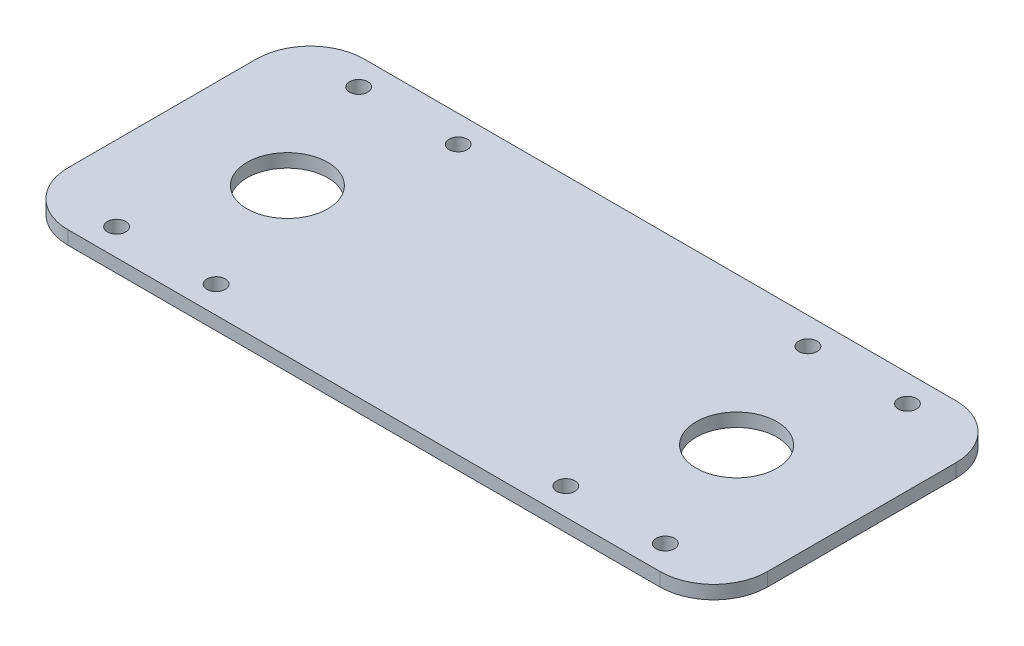
from build123d import *

# Parameters (mm, degrees)
BOSS_EXTRUDE1_DEPTH = 2.5
SKETCH2_R           = 1.7
CUT_EXTRUDE1_DEPTH  = 142.178079035
SKETCH3_R           = 1.7
CUT_EXTRUDE2_DEPTH  = 10
SKETCH4_R           = 7.5
CUT_EXTRUDE3_DEPTH  = 10


with BuildPart() as part:
    # Sketch1 → Boss-Extrude1 (new body)
    with BuildSketch(Plane(origin=(0, 0, 0), x_dir=(1, 0, 0), z_dir=(0, 1, 0))):
        with BuildLine():
            Line((10, 0), (120, 0))
            ThreePointArc((120, 0), (127.071067812, 2.928932188), (130, 10))
            Line((130, 10), (130, 45))
            ThreePointArc((130, 45), (127.071067812, 52.071067812), (120, 55))
            Line((120, 55), (10, 55))
            ThreePointArc((10, 55), (2.928932188, 52.071067812), (0, 45))
            Line((0, 45), (0, 10))
            ThreePointArc((0, 10), (2.928932188, 2.928932188), (10, 0))
        make_face()
    extrude(amount=BOSS_EXTRUDE1_DEPTH)

    # Sketch2 → Cut-Extrude1 (cut, through all)
    with BuildSketch(Plane(origin=(0, 2.5, 0), x_dir=(1, 0, 0), z_dir=(0, 1, 0))):
        with Locations((14, 5)):
            Circle(SKETCH2_R)
        with Locations((14, 50)):
            Circle(SKETCH2_R)
        with Locations((116, 5)):
            Circle(SKETCH2_R)
        with Locations((116, 50)):
            Circle(SKETCH2_R)
    extrude(amount=-CUT_EXTRUDE1_DEPTH, mode=Mode.SUBTRACT)

    # Sketch3 → Cut-Extrude2 (cut)
    with BuildSketch(Plane(origin=(0, 2.5, 0), x_dir=(1, 0, 0), z_dir=(0, 1, 0))):
        with Locations((32.5, 50)):
            Circle(SKETCH3_R)
        with Locations((32.5, 5)):
            Circle(SKETCH3_R)
        with Locations((97.5, 5)):
            Circle(SKETCH3_R)
        with Locations((97.5, 50)):
            Circle(SKETCH3_R)
    extrude(amount=-CUT_EXTRUDE2_DEPTH, mode=Mode.SUBTRACT)

    # Sketch4 → Cut-Extrude3 (cut)
    with BuildSketch(Plane(origin=(0, 2.5, 0), x_dir=(1, 0, 0), z_dir=(0, 1, 0))):
        with Locations((23.25, 27.5)):
            Circle(SKETCH4_R)
        with Locations((106.75, 27.5)):
            Circle(SKETCH4_R)
    extrude(amount=-CUT_EXTRUDE3_DEPTH, mode=Mode.SUBTRACT)


solid = part.part
